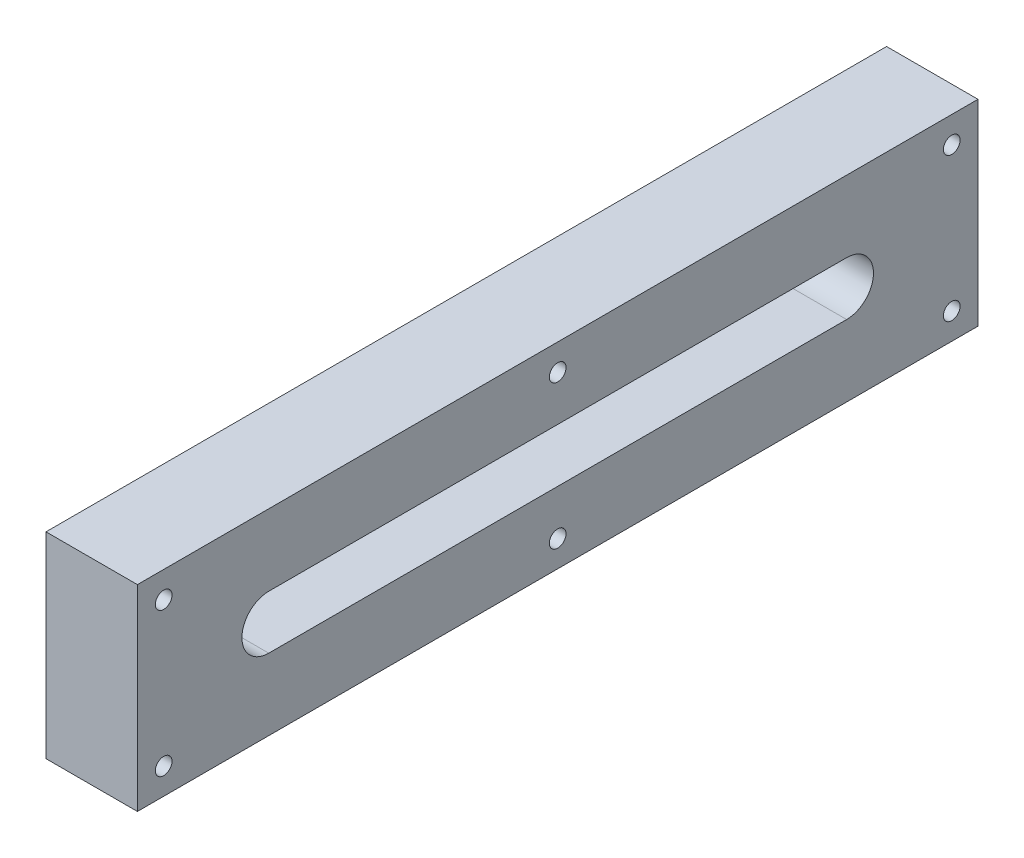
from build123d import *

# Parameters (mm, degrees)
SKETCH1_W              = 203.2
SKETCH1_H              = 47.498
BOSS_EXTRUDE1_DEPTH    = 22.098
CUT_EXTRUDE1_DEPTH     = 17.78
F_10_32_TAPPED_HOLE1_D = 4.0386


with BuildPart() as part:
    # Sketch1 → Boss-Extrude1 (new body)
    with BuildSketch(Plane(origin=(0, 0, 0), x_dir=(0, 0, -1), z_dir=(1, 0, 0))):
        Rectangle(SKETCH1_W, SKETCH1_H)
        with BuildLine():
            Line((-69.85, 2.499995), (69.85, 2.499995))
            ThreePointArc((69.85, 2.499995), (72.349995, 0), (69.85, -2.499995))
            Line((69.85, -2.499995), (-69.85, -2.499995))
            ThreePointArc((-69.85, -2.499995), (-72.349995, 0), (-69.85, 2.499995))
        make_face(mode=Mode.SUBTRACT)
    extrude(amount=BOSS_EXTRUDE1_DEPTH)

    # Sketch2 → Cut-Extrude1 (cut)
    with BuildSketch(Plane(origin=(22.098, 0, 0), x_dir=(0, 0, -1), z_dir=(1, 0, 0))):
        with BuildLine():
            Line((-69.85, 6.4797559), (69.85, 6.4797559))
            ThreePointArc((69.85, 6.4797559), (76.3297559, 0), (69.85, -6.4797559))
            Line((69.85, -6.4797559), (-69.85, -6.4797559))
            ThreePointArc((-69.85, -6.4797559), (-76.3297559, 0), (-69.85, 6.4797559))
        make_face()
    extrude(amount=-CUT_EXTRUDE1_DEPTH, mode=Mode.SUBTRACT)

    # #10-32 Tapped Hole1 (through all)
    with Locations(Plane(origin=(22.098, 0, 0), x_dir=(0, 0, -1), z_dir=(1, 0, 0))):
        with Locations((-95.25, 17.399), (-95.25, -17.399), (0, -17.399), (95.25, -17.399), (95.25, 17.399), (0, 17.399)):
            Hole(F_10_32_TAPPED_HOLE1_D / 2)


solid = part.part
